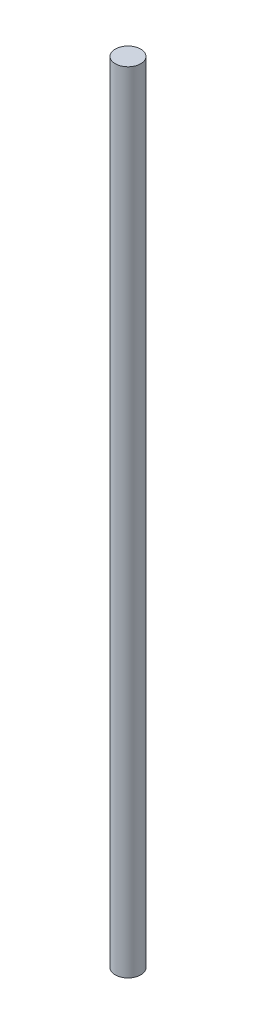
from build123d import *

# Parameters (mm, degrees)
SKETCH1_R           = 3.175
BOSS_EXTRUDE1_DEPTH = 196.85


with BuildPart() as part:
    # Sketch1 → Boss-Extrude1 (new body)
    with BuildSketch(Plane(origin=(0, 0, 0), x_dir=(1, 0, 0), z_dir=(0, 1, 0))):
        Circle(SKETCH1_R)
    extrude(amount=BOSS_EXTRUDE1_DEPTH)


solid = part.part
